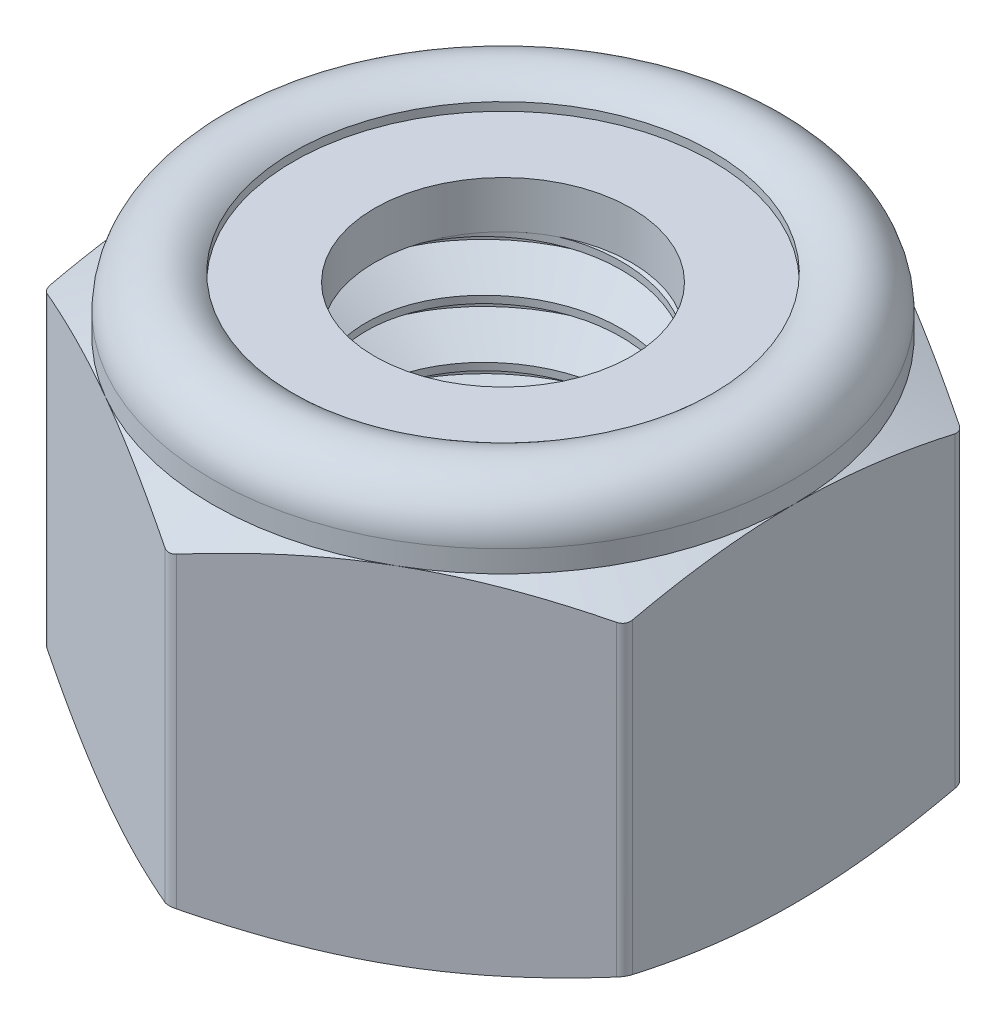
from build123d import *

# Parameters (mm, degrees)
BOSS_EXTRUDE1_DEPTH      = 2.5
BOSS_EXTRUDE1_DEPTH_BACK = 2.5
SKETCH2_R                = 1.545336663
FILLET1_R                = 0.14
SKETCH4_W                = 0.977331669
SKETCH4_H                = 0.565649729
SKETCH6_W                = 2
SKETCH6_H                = 4.166666667
CUT_SWEEP1_PITCH         = 0.7
SKETCH10_R               = 1.945336663
BOSS_EXTRUDE2_DEPTH      = 4.166666667


with BuildPart() as part:
    # Sketch2 → Boss-Extrude1 (new, two sides: drawn at the far end of the back side and taken through both)
    with BuildSketch(Plane(origin=(0, 0, 0), x_dir=(1, 0, 0), z_dir=(0, 1, 0)).offset(-BOSS_EXTRUDE1_DEPTH_BACK)):
        Polygon((0, 4.041451884), (-3.5, 2.020725942), (-3.5, -2.020725942), (0, -4.041451884), (3.5, -2.020725942), (3.5, 2.020725942), align=None)
        with Locations(Location((0, 0, 0), (0, 0, 270))):
            Circle(SKETCH2_R, mode=Mode.SUBTRACT)
    extrude(amount=BOSS_EXTRUDE1_DEPTH + BOSS_EXTRUDE1_DEPTH_BACK)

    # Fillet1
    fillet1_edges = [part.edges().sort_by_distance(p)[0] for p in [
        (3.5, 0, -2.020725942),
        (3.5, 0, 2.020725942),
        (0, 0, 4.041451884),
        (-3.5, 0, 2.020725942),
        (-3.5, 0, -2.020725942),
        (0, 0, -4.041451884),
    ]]
    fillet(fillet1_edges, radius=FILLET1_R)

    # Sketch3 → Cut-Revolve2 (revolve, cut)
    with BuildSketch(Plane(origin=(0, 0, 0), x_dir=(0, 0, -1), z_dir=(1, 0, 0)), mode=Mode.PRIVATE) as cut_revolve2_sk:
        with BuildLine():
            Line((4.041451884, 1.666666667), (4.041451884, 3.5))
            Line((4.041451884, 3.5), (1.545336663, 3.5))
            Line((1.545336663, 3.5), (1.545336663, 1.666666667))
            Line((1.545336663, 1.666666667), (2.522668332, 1.666666667))
            Line((2.522668332, 1.666666667), (2.522668332, 2.332316396))
            ThreePointArc((2.522668332, 2.332316396), (3.146581551, 2.456420451), (3.5, 1.927492364))
            Line((3.5, 1.927492364), (3.5, 1.666666667))
            Line((3.5, 1.666666667), (4.041451884, 1.414183506))
            Line((4.041451884, 1.414183506), (4.041451884, 1.666666667))
        make_face()
        Polygon((3.5, -2.5), (4.041451884, -2.24751684), (4.041451884, -2.5), align=None)
        Polygon((1.545336663, -2.5), (1.545336663, -2.1), (1.945336663, -2.5), align=None)
    revolve(cut_revolve2_sk.sketch.rotate(Axis((0, -2.5, 0), (0, 1, 0)), 270), axis=Axis((0, -2.5, 0), (0, 1, 0)), mode=Mode.SUBTRACT)

    # Sketch10 → Boss-Extrude2 (add)
    with BuildSketch(Plane.XZ.offset(2.5)):
        Circle(SKETCH10_R)
    extrude(amount=-BOSS_EXTRUDE2_DEPTH)


with BuildPart() as body_2:
    # Sketch4 → Revolve1 (revolve)
    with BuildSketch(Plane(origin=(0, 0, 0), x_dir=(0, 0, -1), z_dir=(1, 0, 0)), mode=Mode.PRIVATE) as revolve1_sk:
        with Locations((-2.034002498, 1.949491532)):
            Rectangle(SKETCH4_W, SKETCH4_H)
    revolve(revolve1_sk.sketch.rotate(Axis((0, -2.5, 0), (0, 1, 0)), 90), axis=Axis((0, -2.5, 0), (0, 1, 0)))


with BuildPart() as body_3:
    # Sketch6 → Revolve2 (revolve)
    with BuildSketch(Plane.XY, mode=Mode.PRIVATE) as revolve2_sk:
        with Locations((1, -0.416666666)):
            Rectangle(SKETCH6_W, SKETCH6_H)
    revolve(revolve2_sk.sketch.rotate(Axis((0, -2.5, 0), (0, 1, 0)), 90), axis=Axis((0, -2.5, 0), (0, 1, 0)))

    # Cut-Sweep1: the profile of Sketch8 profile screwed along a right-hand helix of 7.142857 turns, 6 arcs to a turn; built about Z, then put on its axis
    cut_sweep1_z = Axis((0, 0, 0), (0, 0, 1))
    cut_sweep1_corners = [(1.545036663, 0, -0.262673205), (1.545036663, 0, -0.349826795), (2.037888611, 0, -0.634375), (2.075777223, 0, 0.04375)]
    with BuildLine(mode=Mode.PRIVATE) as cut_sweep1_profile:
        Line(cut_sweep1_corners[0], cut_sweep1_corners[1])
        Line(cut_sweep1_corners[1], cut_sweep1_corners[2])
        Line(cut_sweep1_corners[2], cut_sweep1_corners[3])
        Line(cut_sweep1_corners[3], cut_sweep1_corners[0])
    cut_sweep1_cap = Face(cut_sweep1_profile.wire())
    cut_sweep1_turn_angles = [0, 30, 60, 90, 120, 150, 180, 210, 240, 270, 300, 330, 360]
    cut_sweep1_turn_weights = [1, 0.8660254037844387, 1, 0.8660254037844387, 1, 0.8660254037844387, 1, 0.8660254037844387, 1, 0.8660254037844387, 1, 0.8660254037844387, 1]
    cut_sweep1_turn_rails = [Edge.make_bspline([Vector(p[0], p[1], 0).rotate(cut_sweep1_z, cut_sweep1_turn_angles[k]) / cut_sweep1_turn_weights[k] + Vector(0, 0, p[2] + CUT_SWEEP1_PITCH * cut_sweep1_turn_angles[k] / 360) for k in range(13)], [0, 0, 0, 1, 1, 2, 2, 3, 3, 4, 4, 5, 5, 6, 6, 6], 2, cut_sweep1_turn_weights) for p in cut_sweep1_corners]
    cut_sweep1_turn_sides = [Face.make_surface_from_curves(cut_sweep1_turn_rails[p[0]], cut_sweep1_turn_rails[p[1]]) for p in [(0, 1), (1, 2), (2, 3), (3, 0)]]
    cut_sweep1_last_angles = [2520, 2545.714285714, 2571.428571429]
    cut_sweep1_last_weights = [1, 0.90096886790241, 1]
    cut_sweep1_last_rails = [Edge.make_bspline([Vector(p[0], p[1], 0).rotate(cut_sweep1_z, cut_sweep1_last_angles[k]) / cut_sweep1_last_weights[k] + Vector(0, 0, p[2] + CUT_SWEEP1_PITCH * cut_sweep1_last_angles[k] / 360) for k in range(3)], [0, 0, 0, 1, 1, 1], 2, cut_sweep1_last_weights) for p in cut_sweep1_corners]
    cut_sweep1_last_sides = [Face.make_surface_from_curves(cut_sweep1_last_rails[p[0]], cut_sweep1_last_rails[p[1]]) for p in [(0, 1), (1, 2), (2, 3), (3, 0)]]
    cut_sweep1 = Plane(origin=(0, -2.5, 0), x_dir=(1, 0, 0), z_dir=(0, 1, 0)) * Solid(Shell([*[p.moved(Location((0, 0, CUT_SWEEP1_PITCH * i))) for i in range(7) for p in cut_sweep1_turn_sides], *cut_sweep1_last_sides, cut_sweep1_cap, cut_sweep1_cap.rotate(cut_sweep1_z, 2571.428571429).moved(Location((0, 0, CUT_SWEEP1_PITCH * 2571.428571429 / 360)))]))
    add(cut_sweep1, mode=Mode.SUBTRACT)

    # Sketch9 → Revolve3 (revolve)
    with BuildSketch(Plane.XY, mode=Mode.PRIVATE) as revolve3_sk:
        Polygon((0, -0.5), (0, -2.5), (2, -2.5), (2.4, -2.5), (0, -0.1), align=None)
    revolve(revolve3_sk.sketch.rotate(Axis((0, -0.5, 0), (0, -1, 0)), 100.038754431), axis=Axis((0, -0.5, 0), (0, -1, 0)))


with BuildPart() as part_1:
    add(part.part)

    # Combine1: cut body 3
    add(body_3.part, mode=Mode.SUBTRACT)


solid = Compound([body_2.part, part_1.part])
